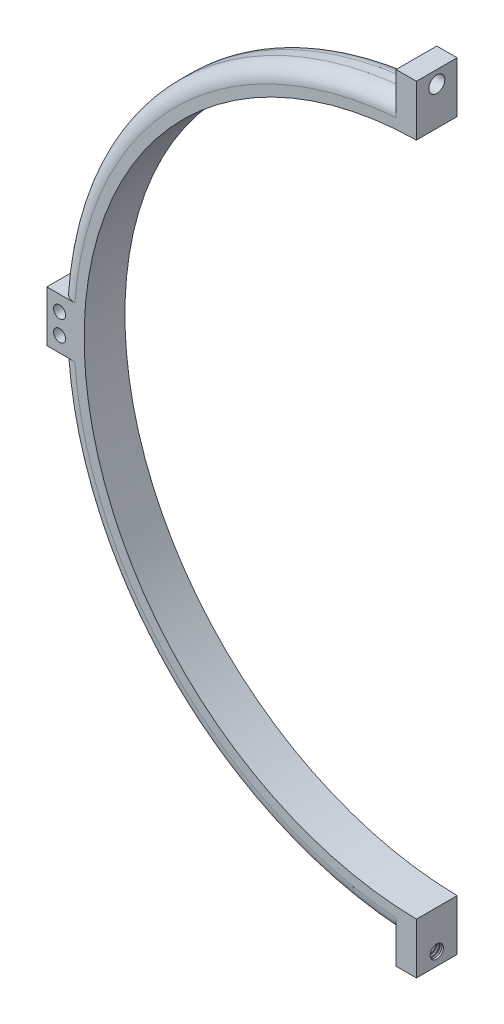
from build123d import *

# Parameters (mm, degrees)
BOSS_EXTRUDE1_DEPTH = 10.16
SKETCH2_R           = 1.5
SKETCH2_W           = 1.27
SKETCH2_H           = 193.675
CUT_EXTRUDE1_DEPTH  = 135.950553
SKETCH3_R           = 2
SKETCH3_R_2         = 1.65
CUT_EXTRUDE2_DEPTH  = 135.07434
THREAD1_PITCH       = 0.7
FILLET3_R           = 3.81


with BuildPart() as part:
    # Sketch1 → Boss-Extrude1 (new body)
    with BuildSketch(Plane.XY):
        with BuildLine():
            Line((0, 84.1375), (0, 96.8375))
            Line((0, 96.8375), (-6.35, 96.8375))
            Line((-6.35, 96.8375), (-6.35, 90.264418))
            ThreePointArc((-6.35, 90.264418), (-63.984325, 63.984325), (-90.264418, 6.35))
            Line((-90.264418, 6.35), (-93.439418, 6.35))
            Line((-93.439418, 6.35), (-93.439418, -6.35))
            Line((-93.439418, -6.35), (-90.264418, -6.35))
            ThreePointArc((-90.264418, -6.35), (-63.984325, -63.984325), (-6.35, -90.264418))
            Line((-6.35, -90.264418), (-6.35, -96.8375))
            Line((-6.35, -96.8375), (0, -96.8375))
            Line((0, -96.8375), (0, -84.1375))
            ThreePointArc((0, -84.1375), (-84.1375, 0), (0, 84.1375))
        make_face()
    extrude(amount=BOSS_EXTRUDE1_DEPTH)

    # Sketch2 → Cut-Extrude1 (cut, through all)
    with BuildSketch(Plane.XY.offset(10.16)):
        with Locations((-90.264418, 2.54)):
            Circle(SKETCH2_R)
        with Locations((-90.264418, -2.54)):
            Circle(SKETCH2_R)
        with Locations((-0.635, 0)):
            Rectangle(SKETCH2_W, SKETCH2_H)
    extrude(amount=-CUT_EXTRUDE1_DEPTH, mode=Mode.SUBTRACT)

    # Sketch3 → Cut-Extrude2 (cut, through all)
    with BuildSketch(Plane(origin=(-1.27, 0, 0), x_dir=(0, 0, -1), z_dir=(1, 0, 0))):
        with Locations(Location((-5.08, 93.660104, 0), (0, 0, 90))):
            Circle(SKETCH3_R)
        with Locations(Location((-5.08, -93.6625, 0), (0, 0, 90))):
            Circle(SKETCH3_R_2)
    extrude(amount=-CUT_EXTRUDE2_DEPTH, mode=Mode.SUBTRACT)

    # Thread1: the profile of Thread Profile1 profile screwed along a right-hand helix of 7.257143 turns, 6 arcs to a turn; built about Z, then put on its axis
    thread1_z = Axis((0, 0, 0), (0, 0, 1))
    thread1_corners = [(1.6497, 0, -0.000173), (2.028886, 0, 0.21875), (2.028886, 0, 0.30625), (1.6497, 0, 0.525173)]
    with BuildLine(mode=Mode.PRIVATE) as thread1_profile:
        Line(thread1_corners[0], thread1_corners[1])
        Line(thread1_corners[1], thread1_corners[2])
        Line(thread1_corners[2], thread1_corners[3])
        Line(thread1_corners[3], thread1_corners[0])
    thread1_cap = Face(thread1_profile.wire())
    thread1_turn_angles = [0, 30, 60, 90, 120, 150, 180, 210, 240, 270, 300, 330, 360]
    thread1_turn_weights = [1, 0.8660254037844387, 1, 0.8660254037844387, 1, 0.8660254037844387, 1, 0.8660254037844387, 1, 0.8660254037844387, 1, 0.8660254037844387, 1]
    thread1_turn_rails = [Edge.make_bspline([Vector(p[0], p[1], 0).rotate(thread1_z, thread1_turn_angles[k]) / thread1_turn_weights[k] + Vector(0, 0, p[2] + THREAD1_PITCH * thread1_turn_angles[k] / 360) for k in range(13)], [0, 0, 0, 1, 1, 2, 2, 3, 3, 4, 4, 5, 5, 6, 6, 6], 2, thread1_turn_weights) for p in thread1_corners]
    thread1_turn_sides = [Face.make_surface_from_curves(thread1_turn_rails[p[0]], thread1_turn_rails[p[1]]) for p in [(0, 1), (1, 2), (2, 3), (3, 0)]]
    thread1_last_angles = [2520, 2550, 2580, 2596.285714, 2612.571429]
    thread1_last_weights = [1, 0.8660254037844387, 1, 0.9598752415428649, 1]
    thread1_last_rails = [Edge.make_bspline([Vector(p[0], p[1], 0).rotate(thread1_z, thread1_last_angles[k]) / thread1_last_weights[k] + Vector(0, 0, p[2] + THREAD1_PITCH * thread1_last_angles[k] / 360) for k in range(5)], [0, 0, 0, 1, 1, 2, 2, 2], 2, thread1_last_weights) for p in thread1_corners]
    thread1_last_sides = [Face.make_surface_from_curves(thread1_last_rails[p[0]], thread1_last_rails[p[1]]) for p in [(0, 1), (1, 2), (2, 3), (3, 0)]]
    thread1 = Plane(origin=(-1.27, -93.6625, 5.08), x_dir=(0, 0, 1), z_dir=(-1, 0, 0)) * Solid(Shell([*[p.moved(Location((0, 0, THREAD1_PITCH * i))) for i in range(7) for p in thread1_turn_sides], *thread1_last_sides, thread1_cap, thread1_cap.rotate(thread1_z, 2612.571429).moved(Location((0, 0, THREAD1_PITCH * 2612.571429 / 360)))]))
    add(thread1, mode=Mode.SUBTRACT)

    # Fillet3
    fillet3_edges = [part.edges().sort_by_distance(p)[0] for p in [
        (-63.984325, -63.984325, 0),
        (-63.984325, 63.984325, 0),
        (-63.984325, 63.984325, 10.16),
        (-63.984325, -63.984325, 10.16),
    ]]
    fillet(fillet3_edges, radius=FILLET3_R)


solid = part.part
